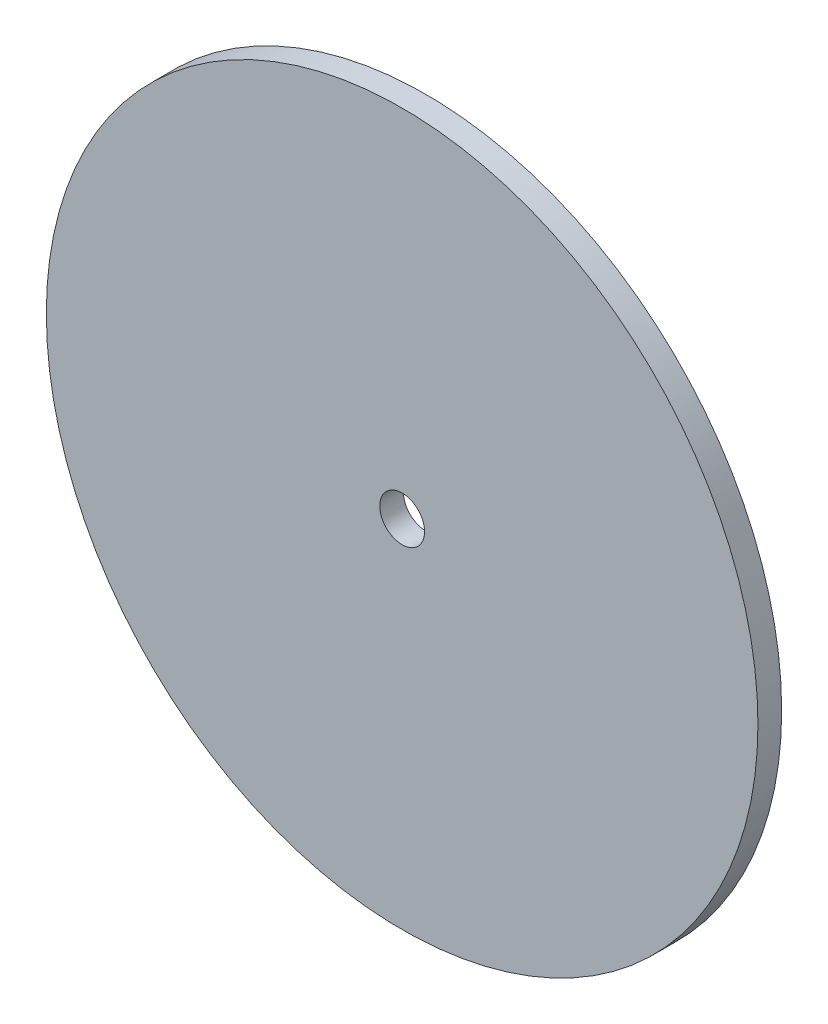
from build123d import *

# Parameters (mm, degrees)
SKETCH1_R           = 19.05
SKETCH1_R_2         = 1.2
BOSS_EXTRUDE1_DEPTH = 1.27
BOSS_EXTRUDE2_DEPTH = 1.27
CIRPATTERN1_COUNT   = 4


with BuildPart() as part:
    # Sketch1 → Boss-Extrude1 (new body)
    with BuildSketch(Plane.XY):
        Circle(SKETCH1_R)
        Circle(SKETCH1_R_2, mode=Mode.SUBTRACT)
    extrude(amount=BOSS_EXTRUDE1_DEPTH)

    # Sketch2 → Boss-Extrude2 (add)
    with BuildSketch(Plane(origin=(0, 0, 0), x_dir=(-1, 0, 0), z_dir=(0, 0, -1))):
        with BuildLine():
            Line((-1.524, 6.318815031), (-1.524, 7.588815031))
            Line((-1.524, 7.588815031), (1.524, 7.588815031))
            Line((1.524, 7.588815031), (1.524, 6.318815031))
            ThreePointArc((1.524, 6.318815031), (0, 6.499999954), (-1.524, 6.318815031))
        make_face()
    boss_extrude2 = extrude(amount=BOSS_EXTRUDE2_DEPTH)

    # CirPattern1: Boss-Extrude2 ×4 about axis
    cirpattern1_axis = Axis((0, 0, 1.27), (0, 0, -1))
    for i in range(1, CIRPATTERN1_COUNT):
        add(boss_extrude2.rotate(cirpattern1_axis, i * 360 / CIRPATTERN1_COUNT))


solid = part.part
